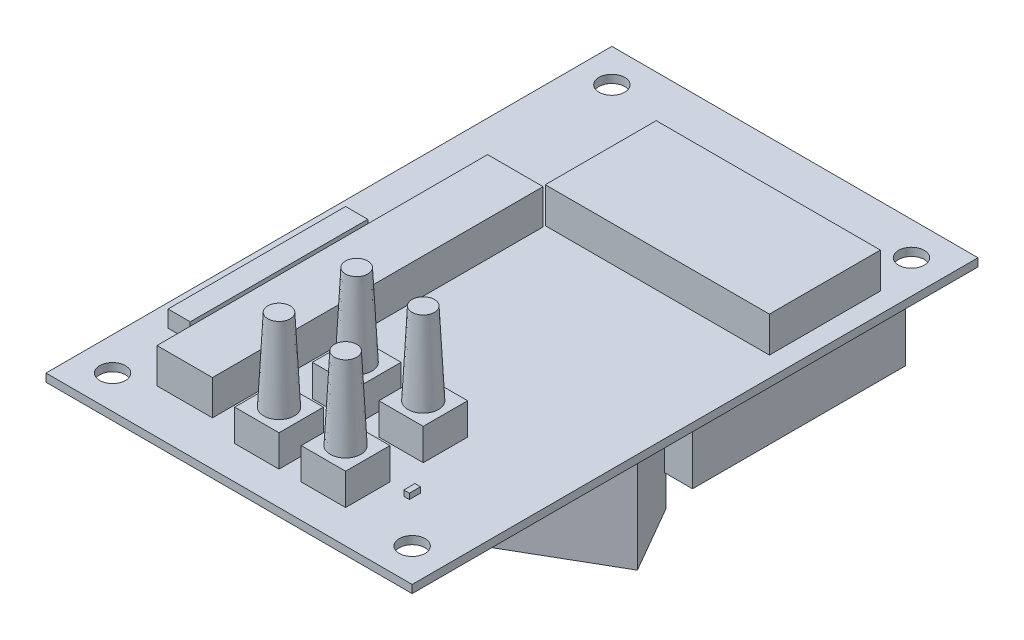
from build123d import *

# Parameters (mm, degrees)
SKETCH1_W                       = 41.91
SKETCH1_H                       = 64.77
BOSS_EXTRUDE1_DEPTH             = 0.9144
BUTTONBASE_W                    = 5.08
BUTTONBASE_H                    = 5.08
BOSS_EXTRUDE2_DEPTH             = 3.6068
SKETCH4_W                       = 25.654
SKETCH4_H                       = 12.7
BOSS_EXTRUDE3_DEPTH             = 4.064
F_32_0_116_DIAMETER_HOLE1_D     = 2.9464
F_32_0_116_DIAMETER_HOLE1_DEPTH = 25.4
F_32_0_116_DIAMETER_HOLE1_TIP   = 0.885187864
SKETCH8_W                       = 0.635
SKETCH8_H                       = 1.27
BOSS_EXTRUDE4_DEPTH             = 0.635
BOSS_EXTRUDE5_DEPTH             = 10.9982
BOSS_EXTRUDE6_DEPTH             = 7.09
SKETCH12_R                      = 1.7526
BOSS_EXTRUDE7_DEPTH             = 9.398
DRAFT5_ANGLE                    = 2.87
SKETCH13_W                      = 6.35
SKETCH13_H                      = 37.846
BOSS_EXTRUDE8_DEPTH             = 4
BOSS_EXTRUDE9_DEPTH             = 8.89
BOSS_EXTRUDE9_DEPTH_BACK        = 2.8194
SKETCH15_W                      = 2.54
SKETCH15_H                      = 20.32


with BuildPart() as part:
    # Sketch1 → Boss-Extrude1 (new body)
    with BuildSketch(Plane(origin=(0, 0, 0), x_dir=(1, 0, 0), z_dir=(0, 1, 0))):
        with Locations((20.955, 32.385)):
            Rectangle(SKETCH1_W, SKETCH1_H)
    extrude(amount=BOSS_EXTRUDE1_DEPTH)

    # ButtonBase → Boss-Extrude2 (add)
    with BuildSketch(Plane(origin=(0, 0.9144, 0), x_dir=(1, 0, 0), z_dir=(0, 1, 0))):
        with Locations((20.32, 15.24)):
            Rectangle(BUTTONBASE_W, BUTTONBASE_H)
        with Locations((27.94, 15.24)):
            Rectangle(BUTTONBASE_W, BUTTONBASE_H)
        with Locations((27.94, 6.35)):
            Rectangle(BUTTONBASE_W, BUTTONBASE_H)
        with Locations((20.32, 6.35)):
            Rectangle(BUTTONBASE_W, BUTTONBASE_H)
    extrude(amount=BOSS_EXTRUDE2_DEPTH)

    # Sketch4 → Boss-Extrude3 (add)
    with BuildSketch(Plane(origin=(0, 0.9144, 0), x_dir=(1, 0, 0), z_dir=(0, 1, 0))):
        with Locations((26.797, 49.53)):
            Rectangle(SKETCH4_W, SKETCH4_H)
    extrude(amount=BOSS_EXTRUDE3_DEPTH)

    # #32 (0.116) Diameter Hole1
    with Locations(Plane(origin=(0, 0.9144, 0), x_dir=(1, 0, 0), z_dir=(0, 1, 0))):
        with Locations((3.81, 60.96), (38.1, 60.96), (38.1, 3.81), (3.81, 3.81)):
            Hole(F_32_0_116_DIAMETER_HOLE1_D / 2, depth=F_32_0_116_DIAMETER_HOLE1_DEPTH)
            with Locations((0, 0, -(F_32_0_116_DIAMETER_HOLE1_DEPTH + F_32_0_116_DIAMETER_HOLE1_TIP / 2))):  # 118° drill point
                Cone(0, F_32_0_116_DIAMETER_HOLE1_D / 2, F_32_0_116_DIAMETER_HOLE1_TIP, mode=Mode.SUBTRACT)

    # Sketch8 → Boss-Extrude4 (add)
    with BuildSketch(Plane(origin=(0, 0.9144, 0), x_dir=(1, 0, 0), z_dir=(0, 1, 0))):
        with Locations((33.02, 8.89)):
            Rectangle(SKETCH8_W, SKETCH8_H)
    extrude(amount=BOSS_EXTRUDE4_DEPTH)

    # Sketch10 → Boss-Extrude5 (add)
    with BuildSketch(Plane.XZ):
        Polygon((41.478212841, -26.21822299), (28.9179, -18.96652299), (24.4221, -26.75347701), (36.982412841, -34.00517701), align=None)
    extrude(amount=BOSS_EXTRUDE5_DEPTH)

    # Sketch11 → Boss-Extrude6 (add)
    with BuildSketch(Plane.XZ):
        Polygon((19.3929, -57.912), (12.8651, -50.3174), (12.8651, -41.1226), (19.3929, -33.528), (40.4749, -33.528), (40.4749, -57.912), align=None)
    extrude(amount=BOSS_EXTRUDE6_DEPTH)

    # Sketch12 → Boss-Extrude7 (add)
    with BuildSketch(Plane(origin=(0, 4.5212, 0), x_dir=(1, 0, 0), z_dir=(0, 1, 0))):
        with Locations((20.32, 15.24)):
            Circle(SKETCH12_R)
        with Locations((27.94, 15.24)):
            Circle(SKETCH12_R)
        with Locations((27.94, 6.35)):
            Circle(SKETCH12_R)
        with Locations((20.32, 6.35)):
            Circle(SKETCH12_R)
    extrude(amount=BOSS_EXTRUDE7_DEPTH)

    # Draft5
    draft5_faces = [part.faces().sort_by_distance(p)[0] for p in [
        (26.1874, 9.2202, -6.35),
        (26.1874, 9.2202, -15.24),
        (18.5674, 9.2202, -15.24),
        (18.5674, 9.2202, -6.35),
    ]]
    draft(draft5_faces, Plane.ZX.offset(4.5212), DRAFT5_ANGLE)

    # Sketch13 → Boss-Extrude8 (add)
    with BuildSketch(Plane(origin=(0, 0.9144, 0), x_dir=(1, 0, 0), z_dir=(0, 1, 0))):
        with Locations((10.795, 24.003)):
            Rectangle(SKETCH13_W, SKETCH13_H)
    extrude(amount=BOSS_EXTRUDE8_DEPTH)

    # Sketch15 → Boss-Extrude9 (add, two sides: drawn at the far end of the back side and taken through both)
    with BuildSketch(Plane(origin=(0, 0, 0), x_dir=(-1, 0, 0), z_dir=(0, -1, 0)).offset(-BOSS_EXTRUDE9_DEPTH_BACK)):
        with Locations((-3.81, 21.59)):
            Rectangle(SKETCH15_W, SKETCH15_H)
    extrude(amount=BOSS_EXTRUDE9_DEPTH + BOSS_EXTRUDE9_DEPTH_BACK)


solid = part.part
